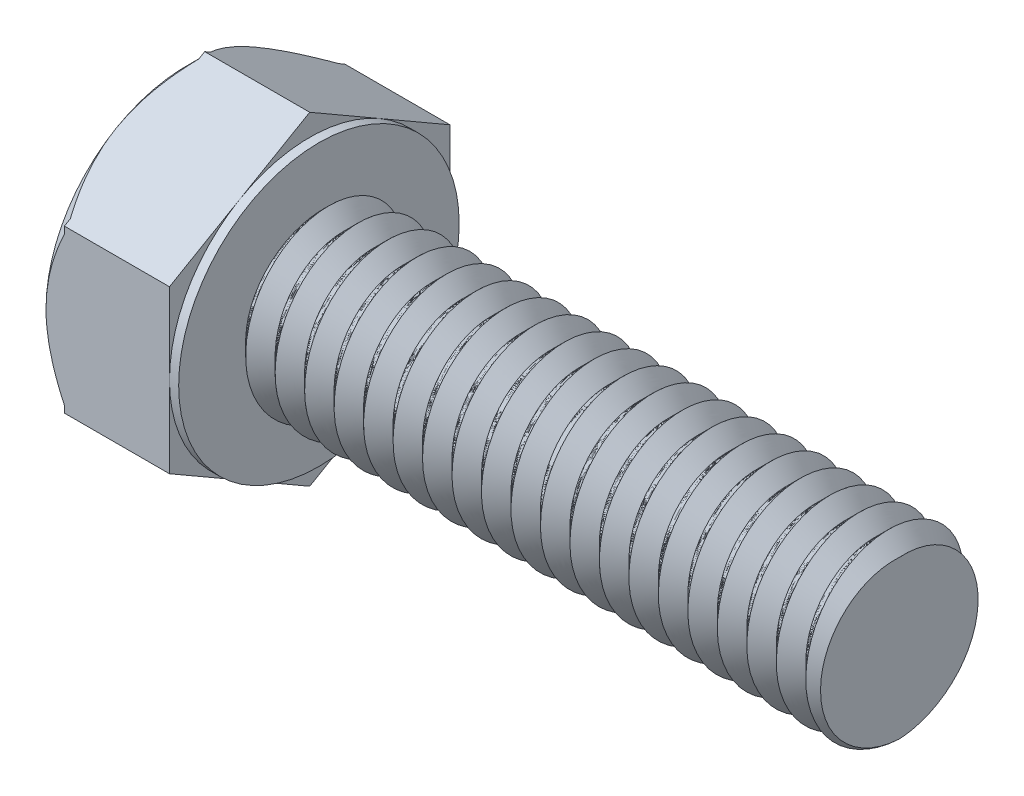
from build123d import *

# Parameters (mm, degrees)
BOSS_EXTRUDE1_DEPTH = 1.675
SKETCH4_R           = 2.5
BOSS_EXTRUDE2_DEPTH = 16
CUT_SWEEP1_PITCH    = 0.8
CUT_SWEEP1_TO       = 16
SKETCH7_OUTSIDE_W   = 15.128
SKETCH7_OUTSIDE_H   = 16.306
SKETCH7_OUTSIDE_R   = 3.80618165
CUT_EXTRUDE3_DEPTH  = 0.5
CUT_EXTRUDE3_DRAFT  = -45
SKETCH8_R           = 3.80618165
BOSS_EXTRUDE3_DEPTH = 0.25


with BuildPart() as part:
    # Sketch3 → Boss-Extrude1 (new, symmetric)
    with BuildSketch(Plane(origin=(0, 0, 0), x_dir=(0, 0, -1), z_dir=(1, 0, 0))):
        Polygon((0, -4.395), (3.80618165, -2.1975), (3.80618165, 2.1975), (0, 4.395), (-3.80618165, 2.1975), (-3.80618165, -2.1975), align=None)
    extrude(amount=BOSS_EXTRUDE1_DEPTH, both=True)

    # Sketch4 → Boss-Extrude2 (add)
    with BuildSketch(Plane(origin=(1.675, 0, 0), x_dir=(0, 0, -1), z_dir=(1, 0, 0))):
        Circle(SKETCH4_R)
    extrude(amount=BOSS_EXTRUDE2_DEPTH)

    # Cut-Sweep1: arcs per turn and ends read off the stored shape
    # Cut-Sweep1: the profile of Sketch5 screwed along a right-hand helix through 22 turns, 8 arcs to a turn; built about Z, then put on its axis
    cut_sweep1_z = Axis((0, 0, 0), (0, 0, 1))
    cut_sweep1_corners = [(2.5, 0, -1.465685425), (1.934314575, 0, -0.9), (2.5, 0, -0.334314575), (3.065685425, 0, -0.9)]
    with BuildLine(mode=Mode.PRIVATE) as cut_sweep1_profile:
        Line(cut_sweep1_corners[0], cut_sweep1_corners[1])
        Line(cut_sweep1_corners[1], cut_sweep1_corners[2])
        Line(cut_sweep1_corners[2], cut_sweep1_corners[3])
        Line(cut_sweep1_corners[3], cut_sweep1_corners[0])
    cut_sweep1_cap = Face(cut_sweep1_profile.wire())
    cut_sweep1_turn_angles = [0, 22.5, 45, 67.5, 90, 112.5, 135, 157.5, 180, 202.5, 225, 247.5, 270, 292.5, 315, 337.5, 360]
    cut_sweep1_turn_weights = [1, 0.9238795325112867, 1, 0.9238795325112867, 1, 0.9238795325112867, 1, 0.9238795325112867, 1, 0.9238795325112867, 1, 0.9238795325112867, 1, 0.9238795325112867, 1, 0.9238795325112867, 1]
    cut_sweep1_turn_rails = [Edge.make_bspline([Vector(p[0], p[1], 0).rotate(cut_sweep1_z, cut_sweep1_turn_angles[k]) / cut_sweep1_turn_weights[k] + Vector(0, 0, p[2] + CUT_SWEEP1_PITCH * cut_sweep1_turn_angles[k] / 360) for k in range(17)], [0, 0, 0, 1, 1, 2, 2, 3, 3, 4, 4, 5, 5, 6, 6, 7, 7, 8, 8, 8], 2, cut_sweep1_turn_weights) for p in cut_sweep1_corners]
    cut_sweep1_turn_sides = [Face.make_surface_from_curves(cut_sweep1_turn_rails[p[0]], cut_sweep1_turn_rails[p[1]]) for p in [(0, 1), (1, 2), (2, 3), (3, 0)]]
    cut_sweep1_turn = Solid(Shell([*cut_sweep1_turn_sides, cut_sweep1_cap, cut_sweep1_cap.rotate(cut_sweep1_z, 360).moved(Location((0, 0, CUT_SWEEP1_PITCH * 360 / 360)))]))
    cut_sweep1_each = [*[cut_sweep1_turn.moved(Location((0, 0, CUT_SWEEP1_PITCH * i))) for i in range(22)]]
    add(Plane(origin=(17.675, 0, 0), x_dir=(0, 0.7071067811865438, 0.7071067811865512), z_dir=(-1, 0, 0)) * split(Compound([cut_sweep1_each[i] for i in range(0, 22, 2)]), bisect_by=Plane.XY.offset(CUT_SWEEP1_TO), keep=Keep.BOTTOM, mode=Mode.PRIVATE), mode=Mode.SUBTRACT)
    add(Plane(origin=(17.675, 0, 0), x_dir=(0, 0.7071067811865438, 0.7071067811865512), z_dir=(-1, 0, 0)) * split(Compound([cut_sweep1_each[i] for i in range(1, 22, 2)]), bisect_by=Plane.XY.offset(CUT_SWEEP1_TO), keep=Keep.BOTTOM, mode=Mode.PRIVATE), mode=Mode.SUBTRACT)


with BuildPart() as cut_extrude3_tool:
    # Sketch7 outside → Cut-Extrude3 (with draft: the straight prism first)
    with BuildSketch(Plane.ZY.offset(1.675)):
        Rectangle(SKETCH7_OUTSIDE_W, SKETCH7_OUTSIDE_H)
        with Locations(Location((0, 0, 0), (0, 0, 180))):
            Circle(SKETCH7_OUTSIDE_R, mode=Mode.SUBTRACT)
    extrude(amount=-CUT_EXTRUDE3_DEPTH)
    # Cut-Extrude3: the draft: its side faces are tilted about the plane it starts from
    cut_extrude3_sides = [cut_extrude3_tool.faces().sort_by_distance(p)[0] for p in [
        (-1.425, -8.153, 0),
        (-1.425, 0, 7.564),
        (-1.425, 8.153, 0),
        (-1.425, 0, -7.564),
        (-1.425, 0, 3.80618165),
    ]]
    draft(cut_extrude3_sides, Plane.ZY.offset(1.675), CUT_EXTRUDE3_DRAFT)


with BuildPart() as part_1:
    add(part.part)

    # Cut-Extrude3: cut by cut_extrude3_tool
    add(cut_extrude3_tool.part, mode=Mode.SUBTRACT)

    # Sketch8 → Boss-Extrude3 (add)
    with BuildSketch(Plane(origin=(1.675, 0, 0), x_dir=(0, 0, -1), z_dir=(1, 0, 0))):
        Circle(SKETCH8_R)
    extrude(amount=BOSS_EXTRUDE3_DEPTH)


solid = part_1.part
